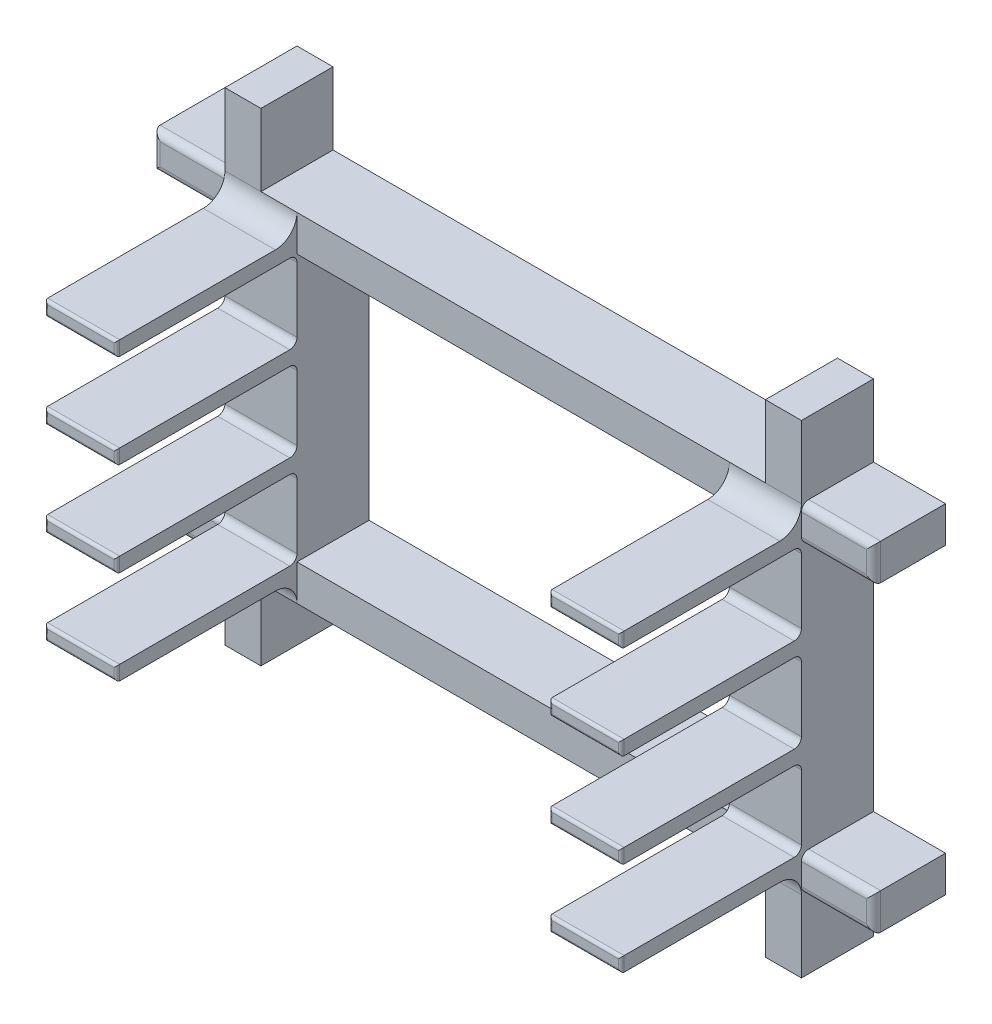
from build123d import *

# Parameters (mm, degrees)
SKETCH2_W           = 37
SKETCH2_H           = 60
BOSS_EXTRUDE1_DEPTH = 10
SKETCH3_W           = 10
SKETCH3_H           = 2
BOSS_EXTRUDE2_DEPTH = 25
FILLET1_R           = 3
FILLET2_R           = 3
FILLET3_R           = 1
FILLET6_START       = -11
FILLET6_DEPTH       = 11
FILLET6_START_2     = -43
FILLET6_2_DEPTH     = 7
FILLET6_3_DEPTH     = 11
FILLET7_START       = -11
FILLET7_DEPTH       = 11
FILLET7_START_2     = -1
FILLET7_2_DEPTH     = 7
FILLET8_R           = 1
FILLET9_R           = 1
FILLET10_R          = 0.4


with BuildPart() as part:
    # Sketch2 → Boss-Extrude1 (new body)
    with BuildSketch(Plane(origin=(0, 0, 0), x_dir=(0, 1, 0), z_dir=(0, 0, 1))):
        Polygon((-42, 10), (-42, 0), (-52, 0), (-52, -5), (-42, -5), (-42, -75), (-52, -75), (-52, -80), (-42, -80), (-42, -90), (-37, -90), (-37, -80), (0, -80), (0, -90), (5, -90), (5, -80), (15, -80), (15, -75), (5, -75), (5, -5), (15, -5), (15, 0), (5, 0), (5, 10), (0, 10), (0, 0), (-37, 0), (-37, 10), align=None)
        with Locations((-18.5, -40)):
            Rectangle(SKETCH2_W, SKETCH2_H, mode=Mode.SUBTRACT)
    extrude(amount=BOSS_EXTRUDE1_DEPTH)

    # Sketch3 → Boss-Extrude2 (add)
    with BuildSketch(Plane.XY.offset(10)):
        with Locations((5, 1)):
            Rectangle(SKETCH3_W, SKETCH3_H)
        with Locations((5, -12)):
            Rectangle(SKETCH3_W, SKETCH3_H)
        with Locations((5, -25)):
            Rectangle(SKETCH3_W, SKETCH3_H)
        with Locations((5, -38)):
            Rectangle(SKETCH3_W, SKETCH3_H)
        with Locations((75, 1)):
            Rectangle(SKETCH3_W, SKETCH3_H)
        with Locations((75, -12)):
            Rectangle(SKETCH3_W, SKETCH3_H)
        with Locations((75, -25)):
            Rectangle(SKETCH3_W, SKETCH3_H)
        with Locations((75, -38)):
            Rectangle(SKETCH3_W, SKETCH3_H)
    extrude(amount=BOSS_EXTRUDE2_DEPTH)

    # Fillet1
    fillet1_edges = [part.edges().sort_by_distance(p)[0] for p in [
        (5, -39, 10),
        (75, -39, 10),
    ]]
    fillet(fillet1_edges, radius=FILLET1_R - 0.0001)  # a hair under: the kernel refuses the full size

    # Fillet2
    fillet2_edges = [part.edges().sort_by_distance(p)[0] for p in [
        (75, 2, 10),
        (5, 2, 10),
    ]]
    fillet(fillet2_edges, radius=FILLET2_R - 0.0001)  # a hair under: the kernel refuses the full size

    # Fillet3
    # the kernel refuses this fillet: 1 mm, written as the material it adds along each edge
    with BuildSketch(Plane(origin=(80, 0, 10), x_dir=(0, -1, 0), z_dir=(-1, 0, 0)), Plane(origin=(10, -26, 10), x_dir=(0, -1, 0), z_dir=(-1, 0, 0)), Plane(origin=(10, -13, 10), x_dir=(0, -1, 0), z_dir=(-1, 0, 0)), Plane(origin=(80, -11, 10), x_dir=(0, 0, 1), z_dir=(-1, 0, 0)), Plane(origin=(80, -24, 10), x_dir=(0, 0, 1), z_dir=(-1, 0, 0)), Plane(origin=(80, -37, 10), x_dir=(0, 0, 1), z_dir=(-1, 0, 0)), Plane(origin=(10, 0, 10), x_dir=(0, -1, 0), z_dir=(-1, 0, 0))) as fillet3_piece_1:
        with BuildLine():
            CenterArc((FILLET3_R, FILLET3_R), FILLET3_R, 180, 90)
            Line((0, FILLET3_R), (0, 0))
            Line((0, 0), (FILLET3_R, 0))
        make_face()
    extrude(amount=10)
    with BuildSketch(Plane(origin=(0, -37, 10), x_dir=(0, 0, 1), z_dir=(1, 0, 0)), Plane(origin=(0, -24, 10), x_dir=(0, 0, 1), z_dir=(1, 0, 0)), Plane(origin=(0, -11, 10), x_dir=(0, 0, 1), z_dir=(1, 0, 0)), Plane(origin=(70, -13, 10), x_dir=(0, -1, 0), z_dir=(1, 0, 0)), Plane(origin=(70, -26, 10), x_dir=(0, -1, 0), z_dir=(1, 0, 0))) as fillet3_piece_2:
        with BuildLine():
            CenterArc((FILLET3_R, -FILLET3_R), FILLET3_R, 90, 90)
            Line((0, -FILLET3_R), (0, 0))
            Line((0, 0), (FILLET3_R, 0))
        make_face()
    extrude(amount=10)

    # Fillet6: read off the stored shape, not the designer's step
    # Fillet6 outline → Fillet6 (cut)
    with BuildSketch(Plane.YZ.offset(FILLET6_START)):
        with BuildLine():
            Line((-42, 10), (-42, 9))
            ThreePointArc((-42, 9), (-41.707106781, 9.707106781), (-41, 10))
            Line((-41, 10), (-42, 10))
        make_face()
    extrude(amount=FILLET6_DEPTH, mode=Mode.SUBTRACT)

    # Fillet6 2 outline → Fillet6 2 (cut)
    with BuildSketch(Plane(origin=(0, 0, 0), x_dir=(1, 0, 0), z_dir=(0, 1, 0)).offset(FILLET6_START_2)):
        with BuildLine():
            ThreePointArc((-9, -10), (-9.707106781, -9.707106781), (-10, -9))
            Line((-10, -9), (-10, -10))
            Line((-10, -10), (-9, -10))
        make_face()
    extrude(amount=FILLET6_2_DEPTH, mode=Mode.SUBTRACT)

    # Fillet6 3 outline → Fillet6 3 (cut)
    with BuildSketch(Plane.YZ.offset(FILLET6_START)):
        with BuildLine():
            ThreePointArc((-38, 10), (-37.292893219, 9.707106781), (-37, 9))
            Line((-37, 9), (-37, 10))
            Line((-37, 10), (-38, 10))
        make_face()
    extrude(amount=FILLET6_3_DEPTH, mode=Mode.SUBTRACT)

    # Fillet7: read off the stored shape, not the designer's step
    # Fillet7 outline → Fillet7 (cut)
    with BuildSketch(Plane.YZ.offset(FILLET7_START)):
        with BuildLine():
            Line((0, 10), (0, 9))
            ThreePointArc((0, 9), (0.292893219, 9.707106781), (1, 10))
            Line((1, 10), (0, 10))
        make_face()
        with BuildLine():
            Line((5, 10), (4, 10))
            ThreePointArc((4, 10), (4.707106781, 9.707106781), (5, 9))
            Line((5, 9), (5, 10))
        make_face()
    extrude(amount=FILLET7_DEPTH, mode=Mode.SUBTRACT)

    # Fillet7 2 outline → Fillet7 2 (cut)
    with BuildSketch(Plane(origin=(0, 0, 0), x_dir=(1, 0, 0), z_dir=(0, 1, 0)).offset(FILLET7_START_2)):
        with BuildLine():
            ThreePointArc((-9, -10), (-9.707106781, -9.707106781), (-10, -9))
            Line((-10, -9), (-10, -10))
            Line((-10, -10), (-9, -10))
        make_face()
    extrude(amount=FILLET7_2_DEPTH, mode=Mode.SUBTRACT)

    # Fillet8
    # the kernel refuses this fillet: 1 mm, written as the material it takes off along each edge
    with BuildSketch(Plane(origin=(80, 0, 10), x_dir=(0, 1, 0), z_dir=(1, 0, 0)), Plane(origin=(92.5, 5, 10), x_dir=(0, -1, 0), z_dir=(-1, 0, 0))) as fillet8_piece_1:
        with BuildLine():
            CenterArc((FILLET8_R, -FILLET8_R), FILLET8_R, 90, 90)
            Line((0, -FILLET8_R), (0, 0))
            Line((0, 0), (FILLET8_R, 0))
        make_face()
    extrude(amount=12.5, mode=Mode.SUBTRACT)
    with BuildSketch(Plane(origin=(90, -2.5, 10), x_dir=(-1, 0, 0), z_dir=(0, 1, 0))) as fillet8_piece_2:
        with BuildLine():
            CenterArc((FILLET8_R, -FILLET8_R), FILLET8_R, 90, 90)
            Line((0, -FILLET8_R), (0, 0))
            Line((0, 0), (FILLET8_R, 0))
        make_face()
    extrude(amount=10, mode=Mode.SUBTRACT)

    # Fillet9
    # the kernel refuses this fillet: 1 mm, written as the material it takes off along each edge
    with BuildSketch(Plane(origin=(80, -42, 10), x_dir=(0, 1, 0), z_dir=(1, 0, 0)), Plane(origin=(92.5, -37, 10), x_dir=(0, -1, 0), z_dir=(-1, 0, 0))) as fillet9_piece_1:
        with BuildLine():
            CenterArc((FILLET9_R, -FILLET9_R), FILLET9_R, 90, 90)
            Line((0, -FILLET9_R), (0, 0))
            Line((0, 0), (FILLET9_R, 0))
        make_face()
    extrude(amount=12.5, mode=Mode.SUBTRACT)
    with BuildSketch(Plane(origin=(90, -44.5, 10), x_dir=(-1, 0, 0), z_dir=(0, 1, 0))) as fillet9_piece_2:
        with BuildLine():
            CenterArc((FILLET9_R, -FILLET9_R), FILLET9_R, 90, 90)
            Line((0, -FILLET9_R), (0, 0))
            Line((0, 0), (FILLET9_R, 0))
        make_face()
    extrude(amount=10, mode=Mode.SUBTRACT)

    # Fillet10
    fillet10_edges = [part.edges().sort_by_distance(p)[0] for p in [
        (75, 0, 35),
        (80, 1, 35),
        (75, 2, 35),
        (70, 1, 35),
        (5, -37, 35),
        (0, -38, 35),
        (5, -39, 35),
        (10, -38, 35),
        (5, -24, 35),
        (0, -25, 35),
        (5, -26, 35),
        (10, -25, 35),
        (5, -11, 35),
        (0, -12, 35),
        (5, -13, 35),
        (10, -12, 35),
        (75, -11, 35),
        (70, -12, 35),
        (75, -13, 35),
        (80, -12, 35),
        (75, -24, 35),
        (70, -25, 35),
        (75, -26, 35),
        (80, -25, 35),
        (75, -37, 35),
        (70, -38, 35),
        (75, -39, 35),
        (80, -38, 35),
        (5, 0, 35),
        (10, 1, 35),
        (5, 2, 35),
        (0, 1, 35),
    ]]
    fillet(fillet10_edges, radius=FILLET10_R)


solid = part.part
